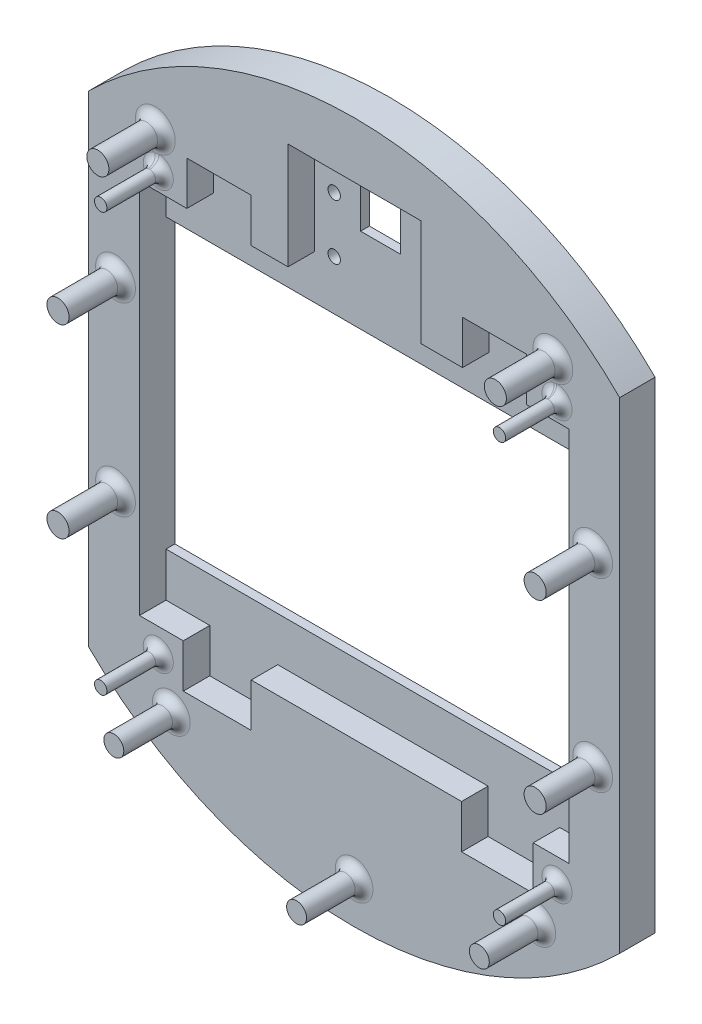
from build123d import *

# Parameters (mm, degrees)
ESBO_O1_W                = 97
ESBO_O1_H                = 65
RESSALTO_EXTRUS_O1_DEPTH = 8
ESBO_O2_W                = 97
ESBO_O2_H                = 85
CORTE_EXTRUS_O1_DEPTH    = 6
ESBO_O3_R                = 2.25
ESBO_O3_R_2              = 2.5
RESSALTO_EXTRUS_O2_DEPTH = 13
FILETE1_R                = 2
CORTE_EXTRUS_O3_DEPTH    = 5
ESBO_O6_R                = 1.4
RESSALTO_EXTRUS_O3_DEPTH = 13
FILETE2_R                = 2
CORTE_EXTRUS_O5_DEPTH    = 6
ESBO_O9_R                = 1.4
ESBO_O9_W                = 9
ESBO_O9_H                = 9
CORTE_EXTRUS_O6_DEPTH    = 181.539394603
CORTE_EXTRUS_O7_DEPTH    = 6


with BuildPart() as part:
    # Esboço1 → Ressalto-extrusão1 (new body)
    with BuildSketch(Plane.XY):
        with BuildLine():
            Line((0, 0), (0, -108.75))
            ThreePointArc((0, -108.75), (60, -133.542027106), (120, -108.75))
            Line((120, -108.75), (120, 0))
            ThreePointArc((120, 0), (60, 24.792027106), (0, 0))
        make_face()
        with Locations((60, -54.375)):
            Rectangle(ESBO_O1_W, ESBO_O1_H, mode=Mode.SUBTRACT)
    extrude(amount=RESSALTO_EXTRUS_O1_DEPTH)

    # Esboço2 → Corte-extrusão1 (cut)
    with BuildSketch(Plane.XY.offset(8)):
        with Locations((60, -54.375)):
            Rectangle(ESBO_O2_W, ESBO_O2_H)
    extrude(amount=-CORTE_EXTRUS_O1_DEPTH, mode=Mode.SUBTRACT)

    # Esboço3 → Ressalto-extrusão2 (add)
    with BuildSketch(Plane.XY.offset(8)):
        with Locations(Location((60, -124.187562439, 0), (0, 0, 180))):
            Circle(ESBO_O3_R)
        with Locations(Location((18.70841508, -112.188026974, 0), (0, 0, 180))):
            Circle(ESBO_O3_R)
        with Locations(Location((101.29158492, -112.188026974, 0), (0, 0, 180))):
            Circle(ESBO_O3_R)
        with Locations(Location((104.90625, 0, 0), (0, 0, 180))):
            Circle(ESBO_O3_R_2)
        with Locations(Location((15.09375, 0, 0), (0, 0, 180))):
            Circle(ESBO_O3_R_2)
        with Locations(Location((6.09375, -75.315, 0), (0, 0, 180))):
            Circle(ESBO_O3_R_2)
        with Locations(Location((6.09375, -33.44, 0), (0, 0, 180))):
            Circle(ESBO_O3_R_2)
        with Locations(Location((113.90625, -75.315, 0), (0, 0, 180))):
            Circle(ESBO_O3_R_2)
        with Locations(Location((113.90625, -33.44, 0), (0, 0, 180))):
            Circle(ESBO_O3_R_2)
    extrude(amount=RESSALTO_EXTRUS_O2_DEPTH)

    # Filete1
    filete1_edges = [part.edges().sort_by_distance(p)[0] for p in [
        (8.59375, -75.315, 8),
        (20.95841508, -112.188026974, 8),
        (62.25, -124.187562439, 8),
        (103.54158492, -112.188026974, 8),
        (116.40625, -75.315, 8),
        (116.40625, -33.44, 8),
        (107.40625, 0, 8),
        (17.59375, 0, 8),
        (8.59375, -33.44, 8),
    ]]
    fillet(filete1_edges, radius=FILETE1_R)

    # Esboço5 → Corte-extrusão3 (cut)
    with BuildSketch(Plane.XY.offset(8)):
        Polygon((47.059331638, -11.875), (47.059331638, 1.210012927), (73.076022221, 1.210012927), (73.076022221, -25.383617561), (47.059331638, -25.383617561), align=None)
    extrude(amount=-CORTE_EXTRUS_O3_DEPTH, mode=Mode.SUBTRACT)

    # Esboço6 → Ressalto-extrusão3 (add)
    with BuildSketch(Plane.XY.offset(8)):
        with Locations(Location((15.75, -7.815, 0), (0, 0, 180))):
            Circle(ESBO_O6_R)
        with Locations(Location((105.85, -102.335, 0), (0, 0, 180))):
            Circle(ESBO_O6_R)
        with Locations(Location((15.75, -102.335, 0), (0, 0, 180))):
            Circle(ESBO_O6_R)
        with Locations(Location((105.85, -7.815, 0), (0, 0, 180))):
            Circle(ESBO_O6_R)
    extrude(amount=RESSALTO_EXTRUS_O3_DEPTH)

    # Filete2
    # the kernel refuses this fillet: 2 mm, written as the material it adds along each edge
    with BuildSketch(Plane(origin=(15.75, -7.815, 8), x_dir=(-1, 0, 0), z_dir=(0, 1, 0))) as filete2_piece_1:
        with BuildLine():
            CenterArc((1.4 + FILETE2_R, FILETE2_R), FILETE2_R, 180, 90)
            Line((1.4, FILETE2_R), (1.4, 0))
            Line((1.4, 0), (1.4 + FILETE2_R, 0))
        make_face()
    revolve(axis=Axis((15.75, -7.815, 8), (0, 0, 1)))
    with BuildSketch(Plane(origin=(105.85, -102.335, 8), x_dir=(-1, 0, 0), z_dir=(0, 1, 0))) as filete2_piece_2:
        with BuildLine():
            CenterArc((1.4 + FILETE2_R, FILETE2_R), FILETE2_R, 180, 90)
            Line((1.4, FILETE2_R), (1.4, 0))
            Line((1.4, 0), (1.4 + FILETE2_R, 0))
        make_face()
    revolve(axis=Axis((105.85, -102.335, 8), (0, 0, 1)))
    with BuildSketch(Plane(origin=(15.75, -102.335, 8), x_dir=(-1, 0, 0), z_dir=(0, 1, 0))) as filete2_piece_3:
        with BuildLine():
            CenterArc((1.4 + FILETE2_R, FILETE2_R), FILETE2_R, 180, 90)
            Line((1.4, FILETE2_R), (1.4, 0))
            Line((1.4, 0), (1.4 + FILETE2_R, 0))
        make_face()
    revolve(axis=Axis((15.75, -102.335, 8), (0, 0, 1)))
    with BuildSketch(Plane(origin=(105.85, -7.815, 8), x_dir=(-1, 0, 0), z_dir=(0, 1, 0))) as filete2_piece_4:
        with BuildLine():
            CenterArc((1.4 + FILETE2_R, FILETE2_R), FILETE2_R, 180, 90)
            Line((1.4, FILETE2_R), (1.4, 0))
            Line((1.4, 0), (1.4 + FILETE2_R, 0))
        make_face()
    revolve(axis=Axis((105.85, -7.815, 8), (0, 0, 1)))

    # Esboço8 → Corte-extrusão5 (cut)
    with BuildSketch(Plane.XY.offset(8)):
        Polygon((45.067676929, 1.210012927), (45.067676929, 12.168164606), (75.067676929, 12.168164606), (75.067676929, -15.935028745), (45.067676929, -15.935028745), align=None)
    extrude(amount=-CORTE_EXTRUS_O5_DEPTH, mode=Mode.SUBTRACT)

    # Esboço9 → Corte-extrusão6 (cut, through all)
    with BuildSketch(Plane.XY.offset(2)):
        with Locations((49.5, -10.635038447)):
            Circle(ESBO_O9_R)
        with Locations((49.5, 1.864961553)):
            Circle(ESBO_O9_R)
        with Locations((70.5, 1.864961553)):
            Circle(ESBO_O9_R)
        with Locations((70.5, -10.635038447)):
            Circle(ESBO_O9_R)
        with Locations((59.968476265, 1.806340881)):
            Rectangle(ESBO_O9_W, ESBO_O9_H)
    extrude(amount=-CORTE_EXTRUS_O6_DEPTH, mode=Mode.SUBTRACT)

    # Esboço10 → Corte-extrusão7 (cut)
    with BuildSketch(Plane.XY.offset(8)):
        Polygon((21.394826421, -96.875), (21.394826421, -106.73233001), (36.751870923, -106.73233001), (36.751870923, -95.23233001), (21.394826421, -95.23233001), align=None)
        Polygon((100.468080416, -95.234738757), (100.468080416, -96.875), (100.468080416, -106.734738757), (84.273843611, -106.734738757), (84.273843611, -95.234738757), align=None)
        Polygon((98.96685342, -12.040231783), (98.96685342, -2.01766999), (84.499857757, -2.01766999), (84.499857757, -13.51766999), (98.96685342, -13.51766999), align=None)
        Polygon((22.209278655, -13.51766999), (22.209278655, -11.875), (22.209278655, -2.01766999), (36.751870923, -2.01766999), (36.751870923, -13.51766999), align=None)
    extrude(amount=-CORTE_EXTRUS_O7_DEPTH, mode=Mode.SUBTRACT)


solid = part.part
